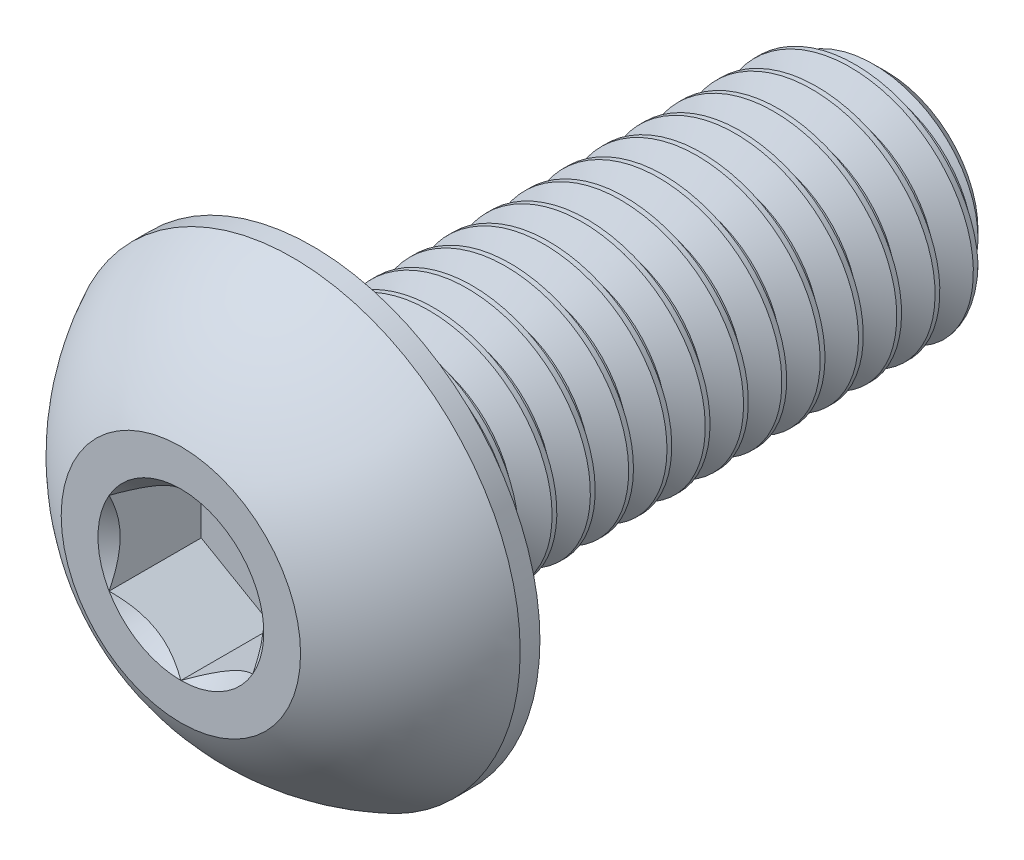
from build123d import *

# Parameters (mm, degrees)
SKETCH1_W          = 12
SKETCH1_H          = 2.5
CHAMFER1_SIZE      = 0.6
CUT_SWEEP1_PITCH   = 0.8
CUT_EXTRUDE2_DEPTH = 1.925


with BuildPart() as part:
    # Sketch1 → Revolve1 (revolve)
    with BuildSketch(Plane(origin=(0, 0, 0), x_dir=(0, 0, -1), z_dir=(1, 0, 0))):
        with Locations((8.75, 1.25)):
            Rectangle(SKETCH1_W, SKETCH1_H)
    revolve(axis=Axis((0, 0, -14.75), (0, 0, 1)))

    # Chamfer1
    chamfer1_edges = [part.edges().sort_by_distance(p)[0] for p in [
        (0, -2.5, -14.75),
    ]]
    chamfer(chamfer1_edges, length=CHAMFER1_SIZE)

    # Cut-Sweep1: the profile of Sketch2 profile screwed along a right-hand helix of 16 turns, 8 arcs to a turn; built about Z, then put on its axis
    cut_sweep1_z = Axis((0, 0, 0), (0, 0, 1))
    cut_sweep1_corners = [(2.5003, 0, 0.000173205), (2.5003, 0, -0.700173205), (1.980384758, 0, -0.4), (1.980384758, 0, -0.3)]
    with BuildLine(mode=Mode.PRIVATE) as cut_sweep1_profile:
        Line(cut_sweep1_corners[0], cut_sweep1_corners[1])
        Line(cut_sweep1_corners[1], cut_sweep1_corners[2])
        Line(cut_sweep1_corners[2], cut_sweep1_corners[3])
        Line(cut_sweep1_corners[3], cut_sweep1_corners[0])
    cut_sweep1_cap = Face(cut_sweep1_profile.wire())
    cut_sweep1_turn_angles = [0, 22.5, 45, 67.5, 90, 112.5, 135, 157.5, 180, 202.5, 225, 247.5, 270, 292.5, 315, 337.5, 360]
    cut_sweep1_turn_weights = [1, 0.9238795325112867, 1, 0.9238795325112867, 1, 0.9238795325112867, 1, 0.9238795325112867, 1, 0.9238795325112867, 1, 0.9238795325112867, 1, 0.9238795325112867, 1, 0.9238795325112867, 1]
    cut_sweep1_turn_rails = [Edge.make_bspline([Vector(p[0], p[1], 0).rotate(cut_sweep1_z, cut_sweep1_turn_angles[k]) / cut_sweep1_turn_weights[k] + Vector(0, 0, p[2] + CUT_SWEEP1_PITCH * cut_sweep1_turn_angles[k] / 360) for k in range(17)], [0, 0, 0, 1, 1, 2, 2, 3, 3, 4, 4, 5, 5, 6, 6, 7, 7, 8, 8, 8], 2, cut_sweep1_turn_weights) for p in cut_sweep1_corners]
    cut_sweep1_turn_sides = [Face.make_surface_from_curves(cut_sweep1_turn_rails[p[0]], cut_sweep1_turn_rails[p[1]]) for p in [(0, 1), (1, 2), (2, 3), (3, 0)]]
    cut_sweep1 = Plane(origin=(0, 0, -14.75), x_dir=(0, 1, 0), z_dir=(0, 0, 1)) * Solid(Shell([*[p.moved(Location((0, 0, CUT_SWEEP1_PITCH * i))) for i in range(16) for p in cut_sweep1_turn_sides], cut_sweep1_cap, cut_sweep1_cap.rotate(cut_sweep1_z, 5760).moved(Location((0, 0, CUT_SWEEP1_PITCH * 5760 / 360)))]))
    add(cut_sweep1, mode=Mode.SUBTRACT)

    # Sketch7 → Revolve2 (revolve)
    with BuildSketch(Plane(origin=(0, 0, 0), x_dir=(0, 0, -1), z_dir=(1, 0, 0)), mode=Mode.PRIVATE) as revolve2_sk:
        with BuildLine():
            Line((2.3375, 4.75), (2.75, 4.75))
            Line((2.75, 4.75), (2.75, 0))
            Line((2.75, 0), (0, 0))
            Line((0, 0), (0, 2.5))
            ThreePointArc((0, 2.5), (0.991875183, 3.808753282), (2.3375, 4.75))
        make_face()
    revolve(revolve2_sk.sketch.rotate(Axis((0, 0, 0), (0, 0, -1)), 189.052465709), axis=Axis((0, 0, 0), (0, 0, -1)))

    # Sketch5 → Cut-Extrude2 (cut)
    with BuildSketch(Plane.XY):
        Polygon((1.5, -0.866025404), (1.5, 0.866025404), (0, 1.732050808), (-1.5, 0.866025404), (-1.5, -0.866025404), (0, -1.732050808), align=None)
    extrude(amount=-CUT_EXTRUDE2_DEPTH, mode=Mode.SUBTRACT)

    # Cut-Extrude3 cone 1 section (through the dimple's axis) → Cut-Extrude3 (revolve, cut)
    with BuildSketch(Plane(origin=(0, 0, 0), x_dir=(0, -1, 0), z_dir=(1, 0, 0))):
        Polygon((0, 0), (1.732050808, 0), (0, 1.732050808), align=None)
    revolve(axis=Axis((0, 0, 0), (0, 0, -1)), mode=Mode.SUBTRACT)


solid = part.part
